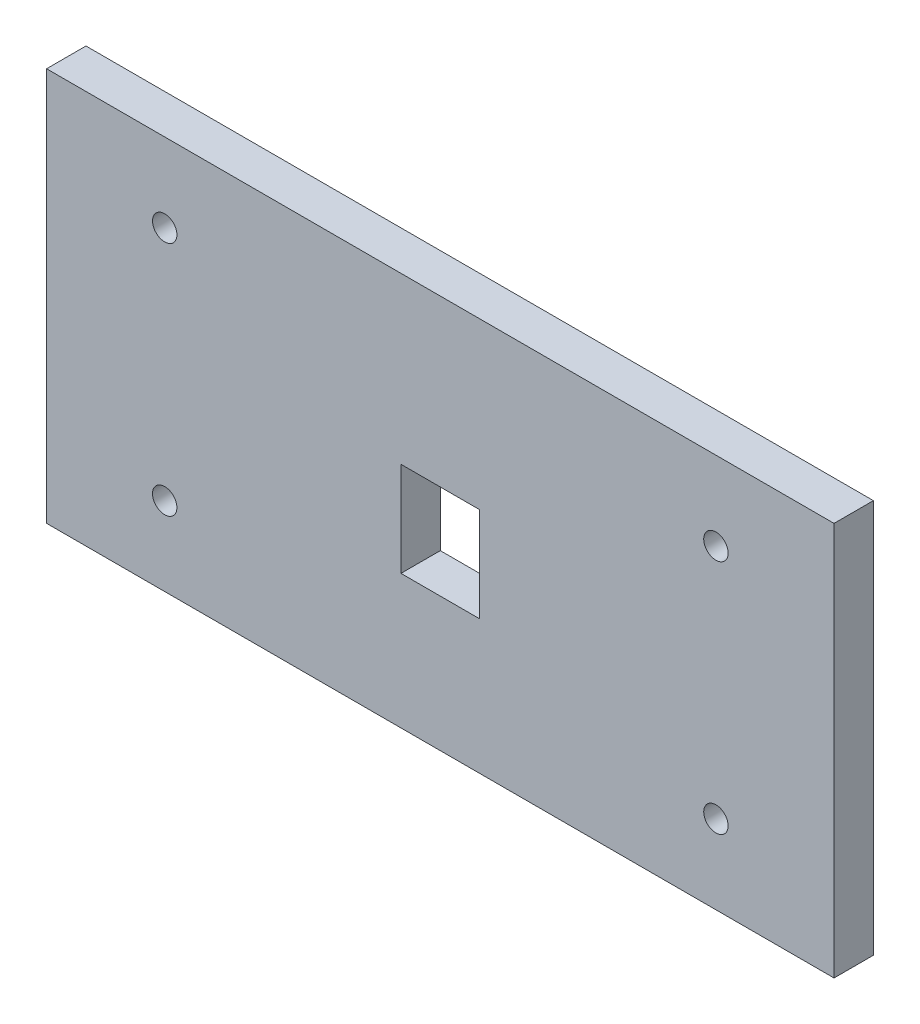
from build123d import *

# Parameters (mm, degrees)
ESQUISSE1_W        = 100
ESQUISSE1_H        = 50
ESQUISSE1_R        = 1.55
ESQUISSE1_W_2      = 10
ESQUISSE1_H_2      = 12
BOSS_EXTRU_1_DEPTH = 5


with BuildPart() as part:
    # Esquisse1 → Boss.-Extru.1 (new body)
    with BuildSketch(Plane.XY):
        Rectangle(ESQUISSE1_W, ESQUISSE1_H)
        with Locations((-35, -15)):
            Circle(ESQUISSE1_R, mode=Mode.SUBTRACT)
        with Locations((35, -15)):
            Circle(ESQUISSE1_R, mode=Mode.SUBTRACT)
        with Locations((35, 15)):
            Circle(ESQUISSE1_R, mode=Mode.SUBTRACT)
        with Locations((-35, 15)):
            Circle(ESQUISSE1_R, mode=Mode.SUBTRACT)
        with Locations((0, -2)):
            Rectangle(ESQUISSE1_W_2, ESQUISSE1_H_2, mode=Mode.SUBTRACT)
    extrude(amount=-BOSS_EXTRU_1_DEPTH)


solid = part.part
